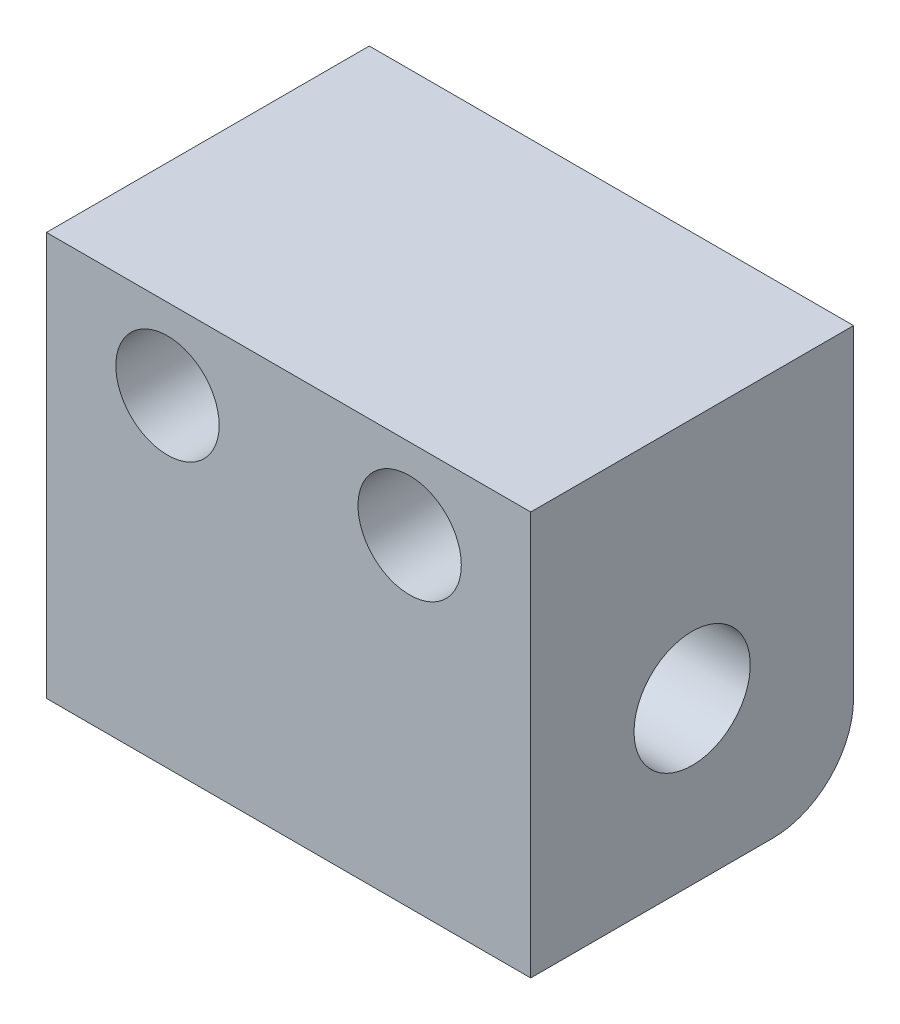
from build123d import *

# Parameters (mm, degrees)
SKETCH1_W           = 19.05
SKETCH1_H           = 15.875
SKETCH1_R           = 2.032
BOSS_EXTRUDE1_DEPTH = 12.7
SKETCH2_R           = 2.286
CUT_EXTRUDE1_DEPTH  = 28.86051193
FILLET1_R           = 3.175


with BuildPart() as part:
    # Sketch1 → Boss-Extrude1 (new body)
    with BuildSketch(Plane.XY):
        with Locations((9.525, 7.9375)):
            Rectangle(SKETCH1_W, SKETCH1_H)
        with Locations((4.7625, 12.7)):
            Circle(SKETCH1_R, mode=Mode.SUBTRACT)
        with Locations((14.2875, 12.7)):
            Circle(SKETCH1_R, mode=Mode.SUBTRACT)
    extrude(amount=BOSS_EXTRUDE1_DEPTH)

    # Sketch2 → Cut-Extrude1 (cut, through all)
    with BuildSketch(Plane.ZY):
        with Locations((6.35, 6.35)):
            Circle(SKETCH2_R)
    extrude(amount=-CUT_EXTRUDE1_DEPTH, mode=Mode.SUBTRACT)

    # Fillet1
    fillet1_edges = [part.edges().sort_by_distance(p)[0] for p in [
        (9.525, 0, 0),
    ]]
    fillet(fillet1_edges, radius=FILLET1_R)


solid = part.part
